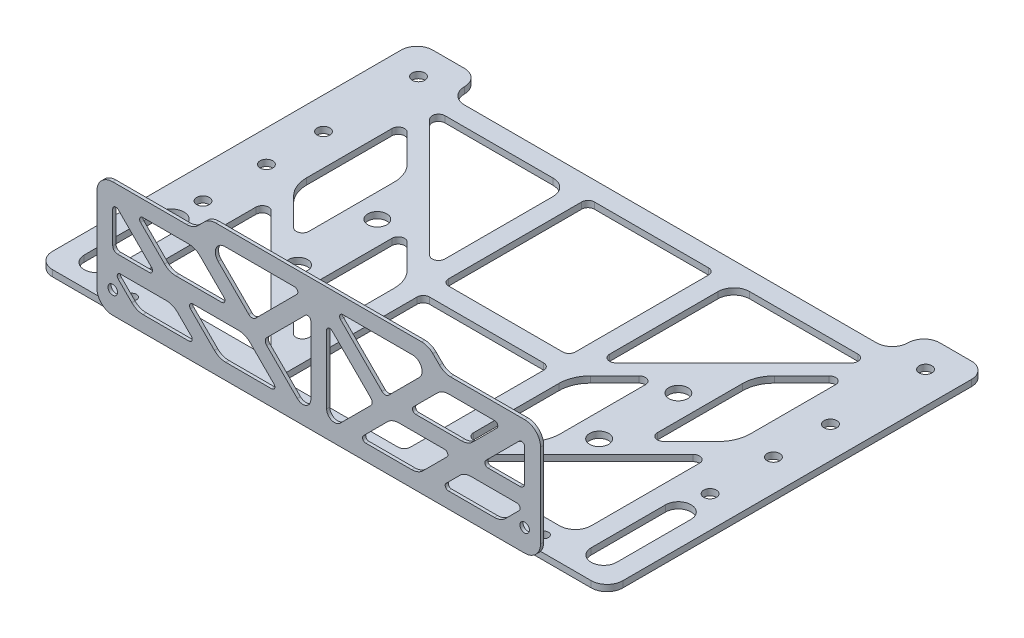
from build123d import *

# Parameters (mm, degrees)
OTHER_208_OUTLINE_R   = 1.5
OTHER_208_OUTLINE_R_2 = 1.25
OTHER_208_OUTLINE_R_3 = 2
OTHER_208_OUTLINE_R_4 = 3
OTHER_208_DEPTH       = 2
OTHER_START           = 58.5
OTHER_208_2_OUTLINE_R = 1.5
OTHER_208_2_DEPTH     = 1
EXTRUDE_START         = -2
SKETCH_2_R            = 2
SKETCH_2_R_2          = 1.5
SKETCH_2_W            = 44
SKETCH_2_H            = 94
EXTRUDE_1_DEPTH       = 2
SKETCH_3_W            = 40
SKETCH_3_H            = 46
CUT_EXTRUDE_1_DEPTH   = 116.941795743
FILLET_1_R            = 2


# Read off the part's stored shape, not the designer's step: 电源管理模块安装板_镜向
with BuildPart() as part:
    # Other 208 outline → Other 208 (new body)
    with BuildSketch(Plane(origin=(0, 0, 0), x_dir=(1, 0, 0), z_dir=(0, 1, 0))):
        with BuildLine():
            ThreePointArc((85, -58.5), (88.535533906, -57.035533906), (90, -53.5))
            Line((90, -53.5), (90, 56.5))
            ThreePointArc((90, 56.5), (88.535533906, 60.035533906), (85, 61.5))
            Line((85, 61.5), (75, 61.5))
            ThreePointArc((75, 61.5), (71.464466094, 60.035533906), (70, 56.5))
            ThreePointArc((70, 56.5), (68.535533906, 52.964466094), (65, 51.5))
            Line((65, 51.5), (-65, 51.5))
            ThreePointArc((-65, 51.5), (-68.535533906, 52.964466094), (-70, 56.5))
            ThreePointArc((-70, 56.5), (-71.464466094, 60.035533906), (-75, 61.5))
            Line((-75, 61.5), (-85, 61.5))
            ThreePointArc((-85, 61.5), (-88.535533906, 60.035533906), (-90, 56.5))
            Line((-90, 56.5), (-90, -53.5))
            ThreePointArc((-90, -53.5), (-88.535533906, -57.035533906), (-85, -58.5))
            Line((-85, -58.5), (85, -58.5))
        make_face()
        with Locations((-65, -53.5)):
            Circle(OTHER_208_OUTLINE_R, mode=Mode.SUBTRACT)
        with BuildLine():
            ThreePointArc((-76, -49.5), (-80, -53.5), (-84, -49.5))
            Line((-84, -49.5), (-84, -26))
            ThreePointArc((-84, -26), (-80, -22), (-76, -26))
            Line((-76, -26), (-76, -49.5))
        make_face(mode=Mode.SUBTRACT)
        with Locations((-21, -31.5)):
            Circle(OTHER_208_OUTLINE_R_2, mode=Mode.SUBTRACT)
        with Locations((-80, -16)):
            Circle(OTHER_208_OUTLINE_R_3, mode=Mode.SUBTRACT)
        with BuildLine():
            ThreePointArc((-65, -48.5), (-68.535533906, -47.035533906), (-70, -43.5))
            Line((-70, -43.5), (-70, -9.328427125))
            ThreePointArc((-70, -9.328427125), (-68.765366865, -7.48066806), (-66.585786438, -7.914213562))
            Line((-66.585786438, -7.914213562), (-29.414213562, -45.085786438))
            ThreePointArc((-29.414213562, -45.085786438), (-28.98066806, -47.265366865), (-30.828427125, -48.5))
            Line((-30.828427125, -48.5), (-65, -48.5))
        make_face(mode=Mode.SUBTRACT)
        with Locations((-47.5, -18.5)):
            Circle(OTHER_208_OUTLINE_R_4, mode=Mode.SUBTRACT)
        with BuildLine():
            ThreePointArc((-28.928932188, -2.642135624), (-26.761204675, -5.886369112), (-26, -9.713203436))
            Line((-26, -9.713203436), (-26, -36.600505063))
            ThreePointArc((-26, -36.600505063), (-27.234633135, -38.448264128), (-29.414213562, -38.014718626))
            Line((-29.414213562, -38.014718626), (-37.071067812, -30.357864376))
            ThreePointArc((-37.071067812, -30.357864376), (-39.238795325, -27.113630888), (-40, -23.286796564))
            Line((-40, -23.286796564), (-40, 3.600505063))
            ThreePointArc((-40, 3.600505063), (-38.765366865, 5.448264128), (-36.585786438, 5.014718626))
            Line((-36.585786438, 5.014718626), (-28.928932188, -2.642135624))
        make_face(mode=Mode.SUBTRACT)
        with BuildLine():
            ThreePointArc((-12.25, -53.5), (-20, -45.75), (-12.25, -38))
            Line((-12.25, -38), (12.25, -38))
            ThreePointArc((12.25, -38), (20, -45.75), (12.25, -53.5))
            Line((12.25, -53.5), (-12.25, -53.5))
        make_face(mode=Mode.SUBTRACT)
        with BuildLine():
            Line((16.5, -28), (16.5, -32))
            ThreePointArc((16.5, -32), (16.207106781, -32.707106781), (15.5, -33))
            Line((15.5, -33), (-15.5, -33))
            ThreePointArc((-15.5, -33), (-16.207106781, -32.707106781), (-16.5, -32))
            Line((-16.5, -32), (-16.5, -28))
            ThreePointArc((-16.5, -28), (-16.207106781, -27.292893219), (-15.5, -27))
            Line((-15.5, -27), (15.5, -27))
            ThreePointArc((15.5, -27), (16.207106781, -27.292893219), (16.5, -28))
        make_face(mode=Mode.SUBTRACT)
        with Locations((21, -31.5)):
            Circle(OTHER_208_OUTLINE_R_2, mode=Mode.SUBTRACT)
        with Locations((65, -53.5)):
            Circle(OTHER_208_OUTLINE_R, mode=Mode.SUBTRACT)
        with BuildLine():
            ThreePointArc((84, -49.5), (80, -53.5), (76, -49.5))
            Line((76, -49.5), (76, -26))
            ThreePointArc((76, -26), (80, -22), (84, -26))
            Line((84, -26), (84, -49.5))
        make_face(mode=Mode.SUBTRACT)
        with BuildLine():
            ThreePointArc((36.585786438, 5.014718626), (38.765366865, 5.448264128), (40, 3.600505063))
            Line((40, 3.600505063), (40, -23.286796564))
            ThreePointArc((40, -23.286796564), (39.238795325, -27.113630888), (37.071067812, -30.357864376))
            Line((37.071067812, -30.357864376), (29.414213562, -38.014718626))
            ThreePointArc((29.414213562, -38.014718626), (27.234633135, -38.448264128), (26, -36.600505063))
            Line((26, -36.600505063), (26, -9.713203436))
            ThreePointArc((26, -9.713203436), (26.761204675, -5.886369112), (28.928932188, -2.642135624))
            Line((28.928932188, -2.642135624), (36.585786438, 5.014718626))
        make_face(mode=Mode.SUBTRACT)
        with BuildLine():
            ThreePointArc((30.828427125, -48.5), (28.98066806, -47.265366865), (29.414213562, -45.085786438))
            Line((29.414213562, -45.085786438), (66.585786438, -7.914213562))
            ThreePointArc((66.585786438, -7.914213562), (68.765366865, -7.48066806), (70, -9.328427125))
            Line((70, -9.328427125), (70, -43.5))
            ThreePointArc((70, -43.5), (68.535533906, -47.035533906), (65, -48.5))
            Line((65, -48.5), (30.828427125, -48.5))
        make_face(mode=Mode.SUBTRACT)
        with Locations((47.5, -18.5)):
            Circle(OTHER_208_OUTLINE_R_4, mode=Mode.SUBTRACT)
        with Locations((80, -16)):
            Circle(OTHER_208_OUTLINE_R_3, mode=Mode.SUBTRACT)
        with Locations((-80, 4)):
            Circle(OTHER_208_OUTLINE_R_3, mode=Mode.SUBTRACT)
        with Locations((-47.5, 6.5)):
            Circle(OTHER_208_OUTLINE_R_4, mode=Mode.SUBTRACT)
        with BuildLine():
            ThreePointArc((-57.928932188, 26.357864376), (-55.761204675, 23.113630888), (-55, 19.286796564))
            Line((-55, 19.286796564), (-55, -7.600505063))
            ThreePointArc((-55, -7.600505063), (-56.234633135, -9.448264128), (-58.414213562, -9.014718626))
            Line((-58.414213562, -9.014718626), (-67.071067812, -0.357864376))
            ThreePointArc((-67.071067812, -0.357864376), (-69.238795325, 2.886369112), (-70, 6.713203436))
            Line((-70, 6.713203436), (-70, 33.600505063))
            ThreePointArc((-70, 33.600505063), (-68.765366865, 35.448264128), (-66.585786438, 35.014718626))
            Line((-66.585786438, 35.014718626), (-57.928932188, 26.357864376))
        make_face(mode=Mode.SUBTRACT)
        with Locations((-80, 22)):
            Circle(OTHER_208_OUTLINE_R_3, mode=Mode.SUBTRACT)
        with BuildLine():
            ThreePointArc((-31, 45.5), (-27.464466094, 44.035533906), (-26, 40.5))
            Line((-26, 40.5), (-26, 6.328427125))
            ThreePointArc((-26, 6.328427125), (-27.234633135, 4.48066806), (-29.414213562, 4.914213562))
            Line((-29.414213562, 4.914213562), (-66.585786438, 42.085786438))
            ThreePointArc((-66.585786438, 42.085786438), (-67.01933194, 44.265366865), (-65.171572875, 45.5))
            Line((-65.171572875, 45.5), (-31, 45.5))
        make_face(mode=Mode.SUBTRACT)
        with Locations((-80, 52)):
            Circle(OTHER_208_OUTLINE_R_3, mode=Mode.SUBTRACT)
        with Locations((-21, 31.5)):
            Circle(OTHER_208_OUTLINE_R_2, mode=Mode.SUBTRACT)
        with BuildLine():
            Line((16.5, 35), (16.5, -21))
            ThreePointArc((16.5, -21), (16.207106781, -21.707106781), (15.5, -22))
            Line((15.5, -22), (-15.5, -22))
            ThreePointArc((-15.5, -22), (-16.207106781, -21.707106781), (-16.5, -21))
            Line((-16.5, -21), (-16.5, 35))
            ThreePointArc((-16.5, 35), (-16.207106781, 35.707106781), (-15.5, 36))
            Line((-15.5, 36), (15.5, 36))
            ThreePointArc((15.5, 36), (16.207106781, 35.707106781), (16.5, 35))
        make_face(mode=Mode.SUBTRACT)
        with Locations((47.5, 6.5)):
            Circle(OTHER_208_OUTLINE_R_4, mode=Mode.SUBTRACT)
        with BuildLine():
            ThreePointArc((66.585786438, 35.014718626), (68.765366865, 35.448264128), (70, 33.600505063))
            Line((70, 33.600505063), (70, 6.713203436))
            ThreePointArc((70, 6.713203436), (69.238795325, 2.886369112), (67.071067812, -0.357864376))
            Line((67.071067812, -0.357864376), (58.414213562, -9.014718626))
            ThreePointArc((58.414213562, -9.014718626), (56.234633135, -9.448264128), (55, -7.600505063))
            Line((55, -7.600505063), (55, 19.286796564))
            ThreePointArc((55, 19.286796564), (55.761204675, 23.113630888), (57.928932188, 26.357864376))
            Line((57.928932188, 26.357864376), (66.585786438, 35.014718626))
        make_face(mode=Mode.SUBTRACT)
        with Locations((80, 4)):
            Circle(OTHER_208_OUTLINE_R_3, mode=Mode.SUBTRACT)
        with BuildLine():
            ThreePointArc((29.414213562, 4.914213562), (27.234633135, 4.48066806), (26, 6.328427125))
            Line((26, 6.328427125), (26, 40.5))
            ThreePointArc((26, 40.5), (27.464466094, 44.035533906), (31, 45.5))
            Line((31, 45.5), (65.171572875, 45.5))
            ThreePointArc((65.171572875, 45.5), (67.01933194, 44.265366865), (66.585786438, 42.085786438))
            Line((66.585786438, 42.085786438), (29.414213562, 4.914213562))
        make_face(mode=Mode.SUBTRACT)
        with Locations((80, 22)):
            Circle(OTHER_208_OUTLINE_R_3, mode=Mode.SUBTRACT)
        with Locations((21, 31.5)):
            Circle(OTHER_208_OUTLINE_R_2, mode=Mode.SUBTRACT)
        with BuildLine():
            ThreePointArc((15.75, 47.5), (20, 43.25), (15.75, 39))
            Line((15.75, 39), (-15.75, 39))
            ThreePointArc((-15.75, 39), (-20, 43.25), (-15.75, 47.5))
            Line((-15.75, 47.5), (15.75, 47.5))
        make_face(mode=Mode.SUBTRACT)
        with Locations((80, 52)):
            Circle(OTHER_208_OUTLINE_R_3, mode=Mode.SUBTRACT)
    extrude(amount=OTHER_208_DEPTH)

    # 草图2 → 凸台-拉伸1 (add)
    with BuildSketch(Plane(origin=(0, 2, 0), x_dir=(1, 0, 0), z_dir=(0, 1, 0)).offset(EXTRUDE_START)):
        with BuildLine():
            Line((90, -53.5), (90, 56.5))
            ThreePointArc((90, 56.5), (88.535533906, 60.035533906), (85, 61.5))
            Line((85, 61.5), (75, 61.5))
            ThreePointArc((75, 61.5), (71.464466094, 60.035533906), (70, 56.5))
            ThreePointArc((70, 56.5), (68.535533906, 52.964466094), (65, 51.5))
            Line((65, 51.5), (-65, 51.5))
            ThreePointArc((-65, 51.5), (-68.535533906, 52.964466094), (-70, 56.5))
            ThreePointArc((-70, 56.5), (-71.464466094, 60.035533906), (-75, 61.5))
            Line((-75, 61.5), (-85, 61.5))
            ThreePointArc((-85, 61.5), (-88.535533906, 60.035533906), (-90, 56.5))
            Line((-90, 56.5), (-90, -53.5))
            ThreePointArc((-90, -53.5), (-88.535533906, -57.035533906), (-85, -58.5))
            Line((-85, -58.5), (85, -58.5))
            ThreePointArc((85, -58.5), (88.535533906, -57.035533906), (90, -53.5))
        make_face()
        with Locations(Location((80, 52, 0), (0, 0, 270))):
            Circle(SKETCH_2_R, mode=Mode.SUBTRACT)
        with Locations(Location((80, 22, 0), (0, 0, 270))):
            Circle(SKETCH_2_R, mode=Mode.SUBTRACT)
        with Locations(Location((80, 4, 0), (0, 0, 270))):
            Circle(SKETCH_2_R, mode=Mode.SUBTRACT)
        with Locations(Location((80, -16, 0), (0, 0, 270))):
            Circle(SKETCH_2_R, mode=Mode.SUBTRACT)
        with Locations(Location((-80, -16, 0), (0, 0, 90))):
            Circle(SKETCH_2_R, mode=Mode.SUBTRACT)
        with Locations(Location((-80, 4, 0), (0, 0, 90))):
            Circle(SKETCH_2_R, mode=Mode.SUBTRACT)
        with Locations(Location((-80, 22, 0), (0, 0, 90))):
            Circle(SKETCH_2_R, mode=Mode.SUBTRACT)
        with Locations(Location((-80, 52, 0), (0, 0, 90))):
            Circle(SKETCH_2_R, mode=Mode.SUBTRACT)
        with Locations(Location((65, -53.5, 0), (0, 0, 270))):
            Circle(SKETCH_2_R_2, mode=Mode.SUBTRACT)
        with Locations(Location((-65, -53.5, 0), (0, 0, 90))):
            Circle(SKETCH_2_R_2, mode=Mode.SUBTRACT)
        with Locations((-48, -1.5)):
            Rectangle(SKETCH_2_W, SKETCH_2_H, mode=Mode.SUBTRACT)
        with Locations((48, -1.5)):
            Rectangle(SKETCH_2_W, SKETCH_2_H, mode=Mode.SUBTRACT)
        with BuildLine():
            Line((76, -49.5), (76, -26))
            ThreePointArc((76, -26), (80, -22), (84, -26))
            Line((84, -26), (84, -49.5))
            ThreePointArc((84, -49.5), (80, -53.5), (76, -49.5))
        make_face(mode=Mode.SUBTRACT)
        with BuildLine():
            Line((-84, -26), (-84, -49.5))
            ThreePointArc((-84, -49.5), (-80, -53.5), (-76, -49.5))
            Line((-76, -49.5), (-76, -26))
            ThreePointArc((-76, -26), (-80, -22), (-84, -26))
        make_face(mode=Mode.SUBTRACT)
    extrude(amount=EXTRUDE_1_DEPTH)

    # 草图3 → 切除-拉伸1 (cut, through all)
    with BuildSketch(Plane(origin=(0, 2, 0), x_dir=(1, 0, 0), z_dir=(0, 1, 0))):
        with Locations((0, 22.5)):
            Rectangle(SKETCH_3_W, SKETCH_3_H)
        with Locations((0, -29.5)):
            Rectangle(SKETCH_3_W, SKETCH_3_H)
    extrude(amount=-CUT_EXTRUDE_1_DEPTH, mode=Mode.SUBTRACT)

    # 圆角1
    fillet_1_edges = [part.edges().sort_by_distance(p)[0] for p in [
        (-20, 1, 0.5),
        (-20, 1, -45.5),
        (20, 1, -45.5),
        (20, 1, 0.5),
        (-20, 1, 52.5),
        (-20, 1, 6.5),
        (20, 1, 6.5),
        (20, 1, 52.5),
    ]]
    fillet(fillet_1_edges, radius=FILLET_1_R)


with BuildPart() as body_2:
    # Other 208 2 outline → Other 208 2 (new body)
    with BuildSketch(Plane.XY.offset(OTHER_START)):
        with BuildLine():
            ThreePointArc((65, 0), (68.535533906, 1.464466094), (70, 5))
            Line((70, 5), (70, 31.5))
            ThreePointArc((70, 31.5), (68.535533906, 35.035533906), (65, 36.5))
            Line((65, 36.5), (41.642135624, 36.5))
            ThreePointArc((41.642135624, 36.5), (39.728718462, 36.880602337), (38.106601718, 37.964466094))
            Line((38.106601718, 37.964466094), (36.035533906, 40.035533906))
            ThreePointArc((36.035533906, 40.035533906), (34.413417162, 41.119397663), (32.5, 41.5))
            Line((32.5, 41.5), (-32.5, 41.5))
            ThreePointArc((-32.5, 41.5), (-34.413417162, 41.119397663), (-36.035533906, 40.035533906))
            Line((-36.035533906, 40.035533906), (-38.106601718, 37.964466094))
            ThreePointArc((-38.106601718, 37.964466094), (-39.728718462, 36.880602337), (-41.642135624, 36.5))
            Line((-41.642135624, 36.5), (-65, 36.5))
            ThreePointArc((-65, 36.5), (-68.535533906, 35.035533906), (-70, 31.5))
            Line((-70, 31.5), (-70, 5))
            ThreePointArc((-70, 5), (-68.535533906, 1.464466094), (-65, 0))
            Line((-65, 0), (65, 0))
        make_face()
        with Locations((-65, 7)):
            Circle(OTHER_208_2_OUTLINE_R, mode=Mode.SUBTRACT)
        with BuildLine():
            ThreePointArc((-48.071067812, 12.5), (-46.15765065, 12.119397663), (-44.535533906, 11.035533906))
            Line((-44.535533906, 11.035533906), (-40.207106781, 6.707106781))
            ThreePointArc((-40.207106781, 6.707106781), (-39.99033403, 5.617316568), (-40.914213562, 5))
            Line((-40.914213562, 5), (-55.428932188, 5))
            ThreePointArc((-55.428932188, 5), (-57.34234935, 5.380602337), (-58.964466094, 6.464466094))
            Line((-58.964466094, 6.464466094), (-63.292893219, 10.792893219))
            ThreePointArc((-63.292893219, 10.792893219), (-63.50966597, 11.882683432), (-62.585786438, 12.5))
            Line((-62.585786438, 12.5), (-48.071067812, 12.5))
        make_face(mode=Mode.SUBTRACT)
        with BuildLine():
            ThreePointArc((-25.25, 15.75), (-23.336582838, 15.369397663), (-21.714466094, 14.285533906))
            Line((-21.714466094, 14.285533906), (-14.136038969, 6.707106781))
            ThreePointArc((-14.136038969, 6.707106781), (-13.919266218, 5.617316567), (-14.843145751, 5))
            Line((-14.843145751, 5), (-29.357864376, 5))
            ThreePointArc((-29.357864376, 5), (-31.271281538, 5.380602337), (-32.893398282, 6.464466094))
            Line((-32.893398282, 6.464466094), (-40.471825407, 14.042893219))
            ThreePointArc((-40.471825407, 14.042893219), (-40.688598158, 15.132683432), (-39.764718626, 15.75))
            Line((-39.764718626, 15.75), (-25.25, 15.75))
        make_face(mode=Mode.SUBTRACT)
        with BuildLine():
            ThreePointArc((-2.5, 8.17766953), (-4.043291419, 5.867970698), (-6.767766953, 6.409902577))
            Line((-6.767766953, 6.409902577), (-16.423728368, 16.065863992))
            ThreePointArc((-16.423728368, 16.065863992), (-16.863068196, 17.126524164), (-16.423728368, 18.187184335))
            Line((-16.423728368, 18.187184335), (-4.207106781, 30.403805922))
            ThreePointArc((-4.207106781, 30.403805922), (-3.117316567, 30.620578674), (-2.5, 29.696699141))
            Line((-2.5, 29.696699141), (-2.5, 8.17766953))
        make_face(mode=Mode.SUBTRACT)
        with BuildLine():
            ThreePointArc((62.585786438, 12.5), (63.50966597, 11.882683432), (63.292893219, 10.792893219))
            Line((63.292893219, 10.792893219), (58.964466094, 6.464466094))
            ThreePointArc((58.964466094, 6.464466094), (57.34234935, 5.380602337), (55.428932188, 5))
            Line((55.428932188, 5), (40.914213562, 5))
            ThreePointArc((40.914213562, 5), (39.99033403, 5.617316568), (40.207106781, 6.707106781))
            Line((40.207106781, 6.707106781), (44.535533906, 11.035533906))
            ThreePointArc((44.535533906, 11.035533906), (46.15765065, 12.119397663), (48.071067812, 12.5))
            Line((48.071067812, 12.5), (62.585786438, 12.5))
        make_face(mode=Mode.SUBTRACT)
        with Locations((65, 7)):
            Circle(OTHER_208_2_OUTLINE_R, mode=Mode.SUBTRACT)
        with BuildLine():
            ThreePointArc((39.764718626, 15.75), (40.688598158, 15.132683432), (40.471825407, 14.042893219))
            Line((40.471825407, 14.042893219), (32.893398282, 6.464466094))
            ThreePointArc((32.893398282, 6.464466094), (31.271281538, 5.380602337), (29.357864376, 5))
            Line((29.357864376, 5), (14.843145751, 5))
            ThreePointArc((14.843145751, 5), (13.919266218, 5.617316567), (14.136038969, 6.707106781))
            Line((14.136038969, 6.707106781), (21.714466094, 14.285533906))
            ThreePointArc((21.714466094, 14.285533906), (23.336582838, 15.369397663), (25.25, 15.75))
            Line((25.25, 15.75), (39.764718626, 15.75))
        make_face(mode=Mode.SUBTRACT)
        with BuildLine():
            ThreePointArc((6.767766953, 6.409902577), (4.043291419, 5.867970698), (2.5, 8.17766953))
            Line((2.5, 8.17766953), (2.5, 29.696699141))
            ThreePointArc((2.5, 29.696699141), (3.117316567, 30.620578674), (4.207106781, 30.403805922))
            Line((4.207106781, 30.403805922), (16.423728368, 18.187184335))
            ThreePointArc((16.423728368, 18.187184335), (16.863068196, 17.126524164), (16.423728368, 16.065863992))
            Line((16.423728368, 16.065863992), (6.767766953, 6.409902577))
        make_face(mode=Mode.SUBTRACT)
        with BuildLine():
            ThreePointArc((-63.5, 17.5), (-64.560660172, 17.939339828), (-65, 19))
            Line((-65, 19), (-65, 29.085786438))
            ThreePointArc((-65, 29.085786438), (-64.382683432, 30.00966597), (-63.292893219, 29.792893219))
            Line((-63.292893219, 29.792893219), (-52.707106781, 19.207106781))
            ThreePointArc((-52.707106781, 19.207106781), (-52.49033403, 18.117316568), (-53.414213562, 17.5))
            Line((-53.414213562, 17.5), (-63.5, 17.5))
        make_face(mode=Mode.SUBTRACT)
        with BuildLine():
            ThreePointArc((-41, 31.5), (-39.086582838, 31.119397663), (-37.464466094, 30.035533906))
            Line((-37.464466094, 30.035533906), (-29.886038969, 22.457106781))
            ThreePointArc((-29.886038969, 22.457106781), (-29.669266218, 21.367316567), (-30.593145751, 20.75))
            Line((-30.593145751, 20.75), (-45.107864376, 20.75))
            ThreePointArc((-45.107864376, 20.75), (-47.021281538, 21.130602337), (-48.643398282, 22.214466094))
            Line((-48.643398282, 22.214466094), (-56.221825407, 29.792893219))
            ThreePointArc((-56.221825407, 29.792893219), (-56.438598158, 30.882683432), (-55.514718626, 31.5))
            Line((-55.514718626, 31.5), (-41, 31.5))
        make_face(mode=Mode.SUBTRACT)
        with BuildLine():
            ThreePointArc((-31.736544033, 31.378679656), (-32.386862287, 34.648050297), (-29.615223689, 36.5))
            Line((-29.615223689, 36.5), (-7.596194078, 36.5))
            ThreePointArc((-7.596194078, 36.5), (-6.672314545, 35.882683433), (-6.889087297, 34.792893219))
            Line((-6.889087297, 34.792893219), (-19.959262274, 21.722718241))
            ThreePointArc((-19.959262274, 21.722718241), (-21.019922446, 21.283378413), (-22.080582618, 21.722718241))
            Line((-22.080582618, 21.722718241), (-31.736544033, 31.378679656))
        make_face(mode=Mode.SUBTRACT)
        with BuildLine():
            ThreePointArc((29.615223689, 36.5), (32.386862287, 34.648050297), (31.736544033, 31.378679656))
            Line((31.736544033, 31.378679656), (22.080582618, 21.722718241))
            ThreePointArc((22.080582618, 21.722718241), (21.019922446, 21.283378413), (19.959262274, 21.722718241))
            Line((19.959262274, 21.722718241), (6.889087297, 34.792893219))
            ThreePointArc((6.889087297, 34.792893219), (6.672314545, 35.882683433), (7.596194078, 36.5))
            Line((7.596194078, 36.5), (29.615223689, 36.5))
        make_face(mode=Mode.SUBTRACT)
        with BuildLine():
            ThreePointArc((63.292893219, 29.792893219), (64.382683432, 30.00966597), (65, 29.085786438))
            Line((65, 29.085786438), (65, 19))
            ThreePointArc((65, 19), (64.560660172, 17.939339828), (63.5, 17.5))
            Line((63.5, 17.5), (53.414213562, 17.5))
            ThreePointArc((53.414213562, 17.5), (52.49033403, 18.117316568), (52.707106781, 19.207106781))
            Line((52.707106781, 19.207106781), (63.292893219, 29.792893219))
        make_face(mode=Mode.SUBTRACT)
        with BuildLine():
            ThreePointArc((55.514718626, 31.5), (56.438598158, 30.882683432), (56.221825407, 29.792893219))
            Line((56.221825407, 29.792893219), (48.643398282, 22.214466094))
            ThreePointArc((48.643398282, 22.214466094), (47.021281538, 21.130602337), (45.107864376, 20.75))
            Line((45.107864376, 20.75), (30.593145751, 20.75))
            ThreePointArc((30.593145751, 20.75), (29.669266218, 21.367316567), (29.886038969, 22.457106781))
            Line((29.886038969, 22.457106781), (37.464466094, 30.035533906))
            ThreePointArc((37.464466094, 30.035533906), (39.086582838, 31.119397663), (41, 31.5))
            Line((41, 31.5), (55.514718626, 31.5))
        make_face(mode=Mode.SUBTRACT)
    extrude(amount=OTHER_208_2_DEPTH)


solid = Compound([part.part, body_2.part])
